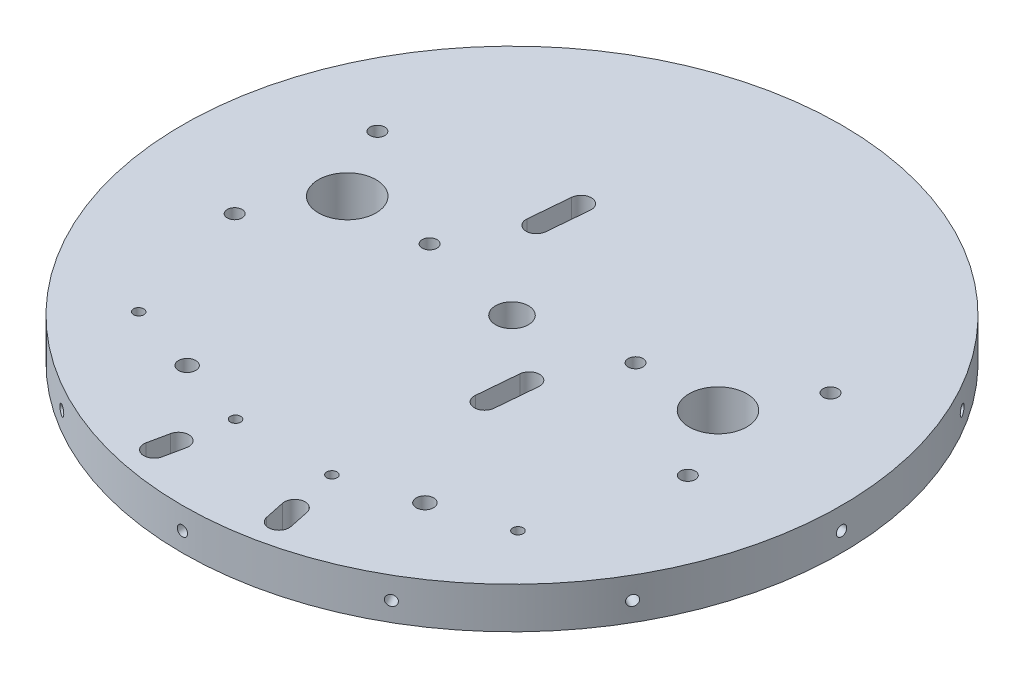
from build123d import *

# Parameters (mm, degrees)
SKETCH1_R           = 80
BOSS_EXTRUDE1_DEPTH = 10
SKETCH3_R           = 4
CUT_EXTRUDE1_DEPTH  = 12
SKETCH4_R           = 7
CUT_EXTRUDE2_DEPTH  = 12
SKETCH5_R           = 1.25
CUT_EXTRUDE3_DEPTH  = 15
CIRPATTERN1_COUNT   = 12
CUT_EXTRUDE4_REACH  = 115.578
SKETCH6_R           = 1.8
SKETCH9_R           = 12.5
CUT_EXTRUDE5_DEPTH  = 3
CUT_EXTRUDE6_REACH  = 115.578
SKETCH10_R          = 2.1
CUT_EXTRUDE7_REACH  = 115.578
SKETCH11_R          = 1.25
CUT_EXTRUDE8_REACH  = 115.578
CUT_EXTRUDE10_REACH = 115.578


with BuildPart() as part:
    # Sketch1 → Boss-Extrude1 (new body)
    with BuildSketch(Plane(origin=(0, 0, 0), x_dir=(1, 0, 0), z_dir=(0, 1, 0))):
        Circle(SKETCH1_R)
    extrude(amount=-BOSS_EXTRUDE1_DEPTH)

    # Sketch3 → Cut-Extrude1 (cut)
    with BuildSketch(Plane(origin=(0, 0, 0), x_dir=(1, 0, 0), z_dir=(0, 1, 0))):
        Circle(SKETCH3_R)
    extrude(amount=-CUT_EXTRUDE1_DEPTH, mode=Mode.SUBTRACT)

    # Sketch4 → Cut-Extrude2 (cut)
    with BuildSketch(Plane(origin=(0, 0, 0), x_dir=(1, 0, 0), z_dir=(0, 1, 0))):
        with Locations((-45, 5)):
            Circle(SKETCH4_R)
        with Locations((45, 5)):
            Circle(SKETCH4_R)
    extrude(amount=-CUT_EXTRUDE2_DEPTH, mode=Mode.SUBTRACT)

    # Sketch5 → Cut-Extrude3 (cut)
    with BuildSketch(Plane.XY.offset(80)):
        with Locations((0, -5.323882396)):
            Circle(SKETCH5_R)
    cut_extrude3 = extrude(amount=-CUT_EXTRUDE3_DEPTH, mode=Mode.SUBTRACT)

    # CirPattern1: Cut-Extrude3 ×12 about axis
    cirpattern1_axis = Axis((0, 0, 0), (0, 1, 0))
    for i in range(1, CIRPATTERN1_COUNT):
        add(cut_extrude3.rotate(cirpattern1_axis, i * 360 / CIRPATTERN1_COUNT), mode=Mode.SUBTRACT)

    # Sketch6 → Cut-Extrude4 (cut, up to next)
    with BuildSketch(Plane(origin=(0, 0, 0), x_dir=(1, 0, 0), z_dir=(0, 1, 0)), mode=Mode.PRIVATE) as cut_extrude4_sk1:
        with Locations((-25, 5)):
            Circle(SKETCH6_R)
    cut_extrude4_tool1 = extrude(cut_extrude4_sk1.sketch, amount=-CUT_EXTRUDE4_REACH, mode=Mode.PRIVATE) & part.part
    # Sketch6 → Cut-Extrude4 (cut, up to next)
    with BuildSketch(Plane(origin=(0, 0, 0), x_dir=(1, 0, 0), z_dir=(0, 1, 0)), mode=Mode.PRIVATE) as cut_extrude4_sk2:
        with Locations((25, 5)):
            Circle(SKETCH6_R)
    cut_extrude4_tool2 = extrude(cut_extrude4_sk2.sketch, amount=-CUT_EXTRUDE4_REACH, mode=Mode.PRIVATE) & part.part
    # Sketch6 → Cut-Extrude4 (cut, up to next)
    with BuildSketch(Plane(origin=(0, 0, 0), x_dir=(1, 0, 0), z_dir=(0, 1, 0)), mode=Mode.PRIVATE) as cut_extrude4_sk3:
        with Locations((-55, 22.320508076)):
            Circle(SKETCH6_R)
    cut_extrude4_tool3 = extrude(cut_extrude4_sk3.sketch, amount=-CUT_EXTRUDE4_REACH, mode=Mode.PRIVATE) & part.part
    # Sketch6 → Cut-Extrude4 (cut, up to next)
    with BuildSketch(Plane(origin=(0, 0, 0), x_dir=(1, 0, 0), z_dir=(0, 1, 0)), mode=Mode.PRIVATE) as cut_extrude4_sk4:
        with Locations((-55, -12.320508076)):
            Circle(SKETCH6_R)
    cut_extrude4_tool4 = extrude(cut_extrude4_sk4.sketch, amount=-CUT_EXTRUDE4_REACH, mode=Mode.PRIVATE) & part.part
    # Sketch6 → Cut-Extrude4 (cut, up to next)
    with BuildSketch(Plane(origin=(0, 0, 0), x_dir=(1, 0, 0), z_dir=(0, 1, 0)), mode=Mode.PRIVATE) as cut_extrude4_sk5:
        with Locations((55, 22.320508076)):
            Circle(SKETCH6_R)
    cut_extrude4_tool5 = extrude(cut_extrude4_sk5.sketch, amount=-CUT_EXTRUDE4_REACH, mode=Mode.PRIVATE) & part.part
    # Sketch6 → Cut-Extrude4 (cut, up to next)
    with BuildSketch(Plane(origin=(0, 0, 0), x_dir=(1, 0, 0), z_dir=(0, 1, 0)), mode=Mode.PRIVATE) as cut_extrude4_sk6:
        with Locations((55, -12.320508076)):
            Circle(SKETCH6_R)
    cut_extrude4_tool6 = extrude(cut_extrude4_sk6.sketch, amount=-CUT_EXTRUDE4_REACH, mode=Mode.PRIVATE) & part.part
    add(cut_extrude4_tool1.solids().sort_by_distance((-25, 0, -5))[0], mode=Mode.SUBTRACT)
    add(cut_extrude4_tool2.solids().sort_by_distance((25, 0, -5))[0], mode=Mode.SUBTRACT)
    add(cut_extrude4_tool3.solids().sort_by_distance((-55, 0, -22.320508))[0], mode=Mode.SUBTRACT)
    add(cut_extrude4_tool4.solids().sort_by_distance((-55, 0, 12.320508))[0], mode=Mode.SUBTRACT)
    add(cut_extrude4_tool5.solids().sort_by_distance((55, 0, -22.320508))[0], mode=Mode.SUBTRACT)
    add(cut_extrude4_tool6.solids().sort_by_distance((55, 0, 12.320508))[0], mode=Mode.SUBTRACT)

    # Sketch9 → Cut-Extrude5 (cut)
    with BuildSketch(Plane.XZ.offset(10)):
        Circle(SKETCH9_R)
    extrude(amount=-CUT_EXTRUDE5_DEPTH, mode=Mode.SUBTRACT)

    # Sketch10 → Cut-Extrude6 (cut, up to next)
    with BuildSketch(Plane(origin=(0, 0, 0), x_dir=(1, 0, 0), z_dir=(0, 1, 0)), mode=Mode.PRIVATE) as cut_extrude6_sk1:
        with Locations((28.867513459, -50)):
            Circle(SKETCH10_R)
    cut_extrude6_tool1 = extrude(cut_extrude6_sk1.sketch, amount=-CUT_EXTRUDE6_REACH, mode=Mode.PRIVATE) & part.part
    # Sketch10 → Cut-Extrude6 (cut, up to next)
    with BuildSketch(Plane(origin=(0, 0, 0), x_dir=(1, 0, 0), z_dir=(0, 1, 0)), mode=Mode.PRIVATE) as cut_extrude6_sk2:
        with Locations((-28.867513459, -50)):
            Circle(SKETCH10_R)
    cut_extrude6_tool2 = extrude(cut_extrude6_sk2.sketch, amount=-CUT_EXTRUDE6_REACH, mode=Mode.PRIVATE) & part.part
    add(cut_extrude6_tool1.solids().sort_by_distance((28.867513, 0, 50))[0], mode=Mode.SUBTRACT)
    add(cut_extrude6_tool2.solids().sort_by_distance((-28.867513, 0, 50))[0], mode=Mode.SUBTRACT)

    # Sketch11 → Cut-Extrude7 (cut, up to next)
    with BuildSketch(Plane(origin=(0, 0, 0), x_dir=(1, 0, 0), z_dir=(0, 1, 0)), mode=Mode.PRIVATE) as cut_extrude7_sk1:
        with Locations((11.700608346, -55.412704391)):
            Circle(SKETCH11_R)
    cut_extrude7_tool1 = extrude(cut_extrude7_sk1.sketch, amount=-CUT_EXTRUDE7_REACH, mode=Mode.PRIVATE) & part.part
    # Sketch11 → Cut-Extrude7 (cut, up to next)
    with BuildSketch(Plane(origin=(0, 0, 0), x_dir=(1, 0, 0), z_dir=(0, 1, 0)), mode=Mode.PRIVATE) as cut_extrude7_sk2:
        with Locations((-11.700608346, -55.412704391)):
            Circle(SKETCH11_R)
    cut_extrude7_tool2 = extrude(cut_extrude7_sk2.sketch, amount=-CUT_EXTRUDE7_REACH, mode=Mode.PRIVATE) & part.part
    # Sketch11 → Cut-Extrude7 (cut, up to next)
    with BuildSketch(Plane(origin=(0, 0, 0), x_dir=(1, 0, 0), z_dir=(0, 1, 0)), mode=Mode.PRIVATE) as cut_extrude7_sk3:
        with Locations((46.034418573, -44.587295609)):
            Circle(SKETCH11_R)
    cut_extrude7_tool3 = extrude(cut_extrude7_sk3.sketch, amount=-CUT_EXTRUDE7_REACH, mode=Mode.PRIVATE) & part.part
    # Sketch11 → Cut-Extrude7 (cut, up to next)
    with BuildSketch(Plane(origin=(0, 0, 0), x_dir=(1, 0, 0), z_dir=(0, 1, 0)), mode=Mode.PRIVATE) as cut_extrude7_sk4:
        with Locations((-46.034418573, -44.587295609)):
            Circle(SKETCH11_R)
    cut_extrude7_tool4 = extrude(cut_extrude7_sk4.sketch, amount=-CUT_EXTRUDE7_REACH, mode=Mode.PRIVATE) & part.part
    add(cut_extrude7_tool1.solids().sort_by_distance((11.700608, 0, 55.412704))[0], mode=Mode.SUBTRACT)
    add(cut_extrude7_tool2.solids().sort_by_distance((-11.700608, 0, 55.412704))[0], mode=Mode.SUBTRACT)
    add(cut_extrude7_tool3.solids().sort_by_distance((46.034419, 0, 44.587296))[0], mode=Mode.SUBTRACT)
    add(cut_extrude7_tool4.solids().sort_by_distance((-46.034419, 0, 44.587296))[0], mode=Mode.SUBTRACT)

    # Sketch12 → Cut-Extrude8 (cut, up to next)
    with BuildSketch(Plane(origin=(0, 0, 0), x_dir=(1, 0, 0), z_dir=(0, 1, 0)), mode=Mode.PRIVATE) as cut_extrude8_sk1:
        with BuildLine():
            Line((16.560305659, -66.326889066), (17.593297776, -71.219018182))
            ThreePointArc((17.593297776, -71.219018182), (15.663729276, -74.181578798), (12.701168659, -72.252010298))
            Line((12.701168659, -72.252010298), (11.668176543, -67.359881182))
            ThreePointArc((11.668176543, -67.359881182), (13.597745043, -64.397320566), (16.560305659, -66.326889066))
        make_face()
    cut_extrude8_tool1 = extrude(cut_extrude8_sk1.sketch, amount=-CUT_EXTRUDE8_REACH, mode=Mode.PRIVATE) & part.part
    # Sketch12 → Cut-Extrude8 (cut, up to next)
    with BuildSketch(Plane(origin=(0, 0, 0), x_dir=(1, 0, 0), z_dir=(0, 1, 0)), mode=Mode.PRIVATE) as cut_extrude8_sk2:
        with BuildLine():
            Line((-11.668176543, -67.359881182), (-12.701168659, -72.252010298))
            ThreePointArc((-12.701168659, -72.252010298), (-15.663729276, -74.181578798), (-17.593297776, -71.219018182))
            Line((-17.593297776, -71.219018182), (-16.560305659, -66.326889066))
            ThreePointArc((-16.560305659, -66.326889066), (-13.597745043, -64.397320566), (-11.668176543, -67.359881182))
        make_face()
    cut_extrude8_tool2 = extrude(cut_extrude8_sk2.sketch, amount=-CUT_EXTRUDE8_REACH, mode=Mode.PRIVATE) & part.part
    add(cut_extrude8_tool1.solids().sort_by_distance((14.630737, 0, 69.28945))[0], mode=Mode.SUBTRACT)
    add(cut_extrude8_tool2.solids().sort_by_distance((-14.630737, 0, 69.28945))[0], mode=Mode.SUBTRACT)

    # Sketch13 → Cut-Extrude10 (cut, up to next)
    with BuildSketch(Plane(origin=(0, 0, 0), x_dir=(1, 0, 0), z_dir=(0, 1, 0)), mode=Mode.PRIVATE) as cut_extrude10_sk1:
        with BuildLine():
            Line((17.38483505, -21.751421731), (18.256392478, -11.78947475))
            ThreePointArc((18.256392478, -11.78947475), (15.98379509, -9.081098648), (13.275418987, -11.353696036))
            Line((13.275418987, -11.353696036), (12.40386156, -21.315643017))
            ThreePointArc((12.40386156, -21.315643017), (14.676458948, -24.024019119), (17.38483505, -21.751421731))
        make_face()
    cut_extrude10_tool1 = extrude(cut_extrude10_sk1.sketch, amount=-CUT_EXTRUDE10_REACH, mode=Mode.PRIVATE) & part.part
    # Sketch13 → Cut-Extrude10 (cut, up to next)
    with BuildSketch(Plane(origin=(0, 0, 0), x_dir=(1, 0, 0), z_dir=(0, 1, 0)), mode=Mode.PRIVATE) as cut_extrude10_sk2:
        with BuildLine():
            Line((-13.227402612, 24.138411415), (-12.573734541, 31.609871651))
            ThreePointArc((-12.573734541, 31.609871651), (-14.846331929, 34.318247753), (-17.554708031, 32.045650365))
            Line((-17.554708031, 32.045650365), (-18.426265459, 22.083703384))
            ThreePointArc((-18.426265459, 22.083703384), (-16.153668071, 19.375327282), (-13.445291969, 21.64792467))
            Line((-13.445291969, 21.64792467), (-13.227402612, 24.138411415))
        make_face()
    cut_extrude10_tool2 = extrude(cut_extrude10_sk2.sketch, amount=-CUT_EXTRUDE10_REACH, mode=Mode.PRIVATE) & part.part
    add(cut_extrude10_tool1.solids().sort_by_distance((15.330127, 0, 16.552559))[0], mode=Mode.SUBTRACT)
    add(cut_extrude10_tool2.solids().sort_by_distance((-15.5, 0, -26.846788))[0], mode=Mode.SUBTRACT)


solid = part.part
